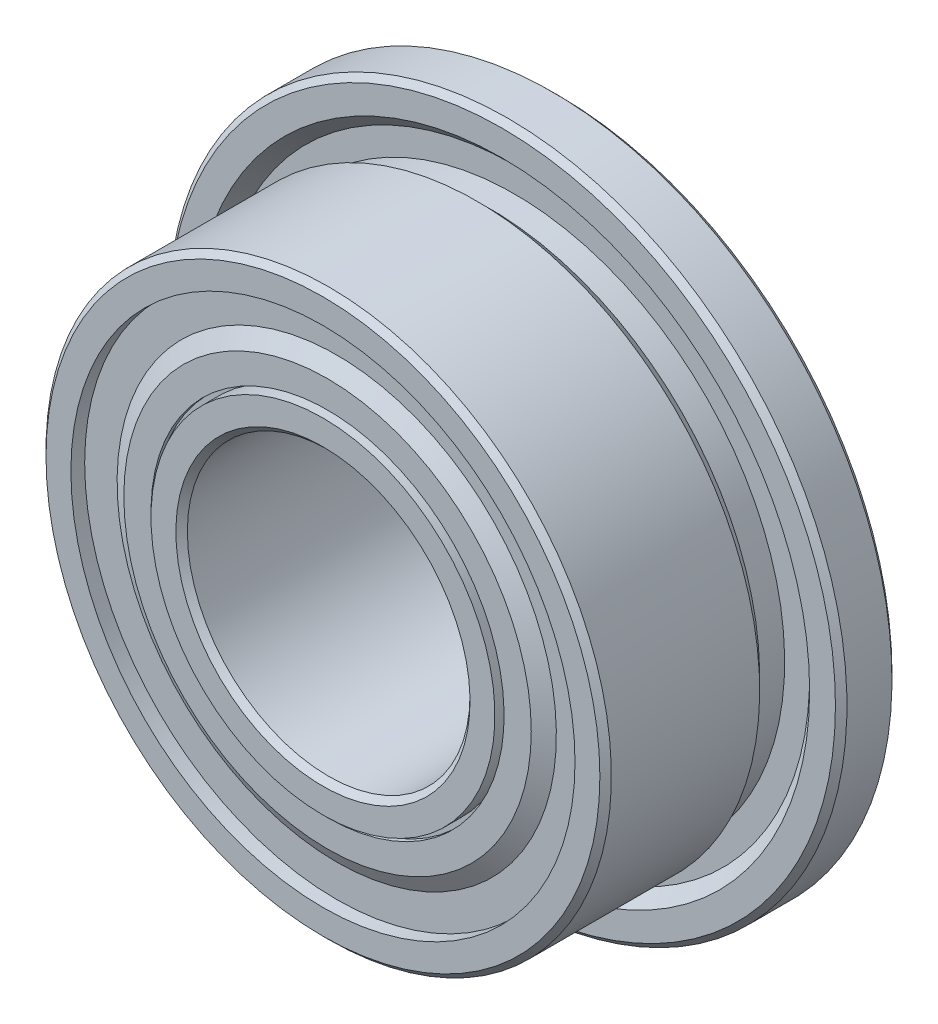
from build123d import *

# Parameters (mm, degrees)
FILLET1_SIZE      = 0.0609375
FILLET2_SIZE      = 0.0609375
CIRPATTERN3_COUNT = 14
SKETCH8_W         = 0.195
SKETCH8_H         = 0.1625


with BuildPart() as part:
    # Sketch2 → Revolve1 (revolve)
    with BuildSketch(Plane(origin=(0, 0, 0), x_dir=(0, 0, -1), z_dir=(1, 0, 0))):
        with BuildLine():
            Line((1.25, 3.6), (0.65, 3.6))
            Line((0.65, 3.6), (0.65, 3.265165043))
            Line((0.65, 3.265165043), (0.782582521, 3.132582521))
            Line((0.782582521, 3.132582521), (0.782582521, 2.867417479))
            Line((0.782582521, 2.867417479), (0.517417479, 2.867417479))
            Line((0.517417479, 2.867417479), (0.384834957, 3))
            Line((0.384834957, 3), (-1.25, 3))
            Line((-1.25, 3), (-1.25, 2.5125))
            Line((-1.25, 2.5125), (-0.301817412, 2.5125))
            ThreePointArc((-0.301817412, 2.5125), (0, 2.65), (0.301817412, 2.5125))
            Line((0.301817412, 2.5125), (1.25, 2.5125))
            Line((1.25, 2.5125), (1.25, 3.6))
        make_face()
        with BuildLine():
            Line((1.25, 1.5), (-1.25, 1.5))
            Line((-1.25, 1.5), (-1.25, 1.9875))
            Line((-1.25, 1.9875), (-0.301817412, 1.9875))
            ThreePointArc((-0.301817412, 1.9875), (0, 1.85), (0.301817412, 1.9875))
            Line((0.301817412, 1.9875), (1.25, 1.9875))
            Line((1.25, 1.9875), (1.25, 1.5))
        make_face()
    revolve(axis=Axis((0, 0, 0), (0, 0, -1)))

    # Fillet1
    fillet1_edges = [part.edges().sort_by_distance(p)[0] for p in [
        (0, -3.6, -1.25),
        (0, -3.6, -0.65),
        (0, -3, 1.25),
    ]]
    chamfer(fillet1_edges, length=FILLET1_SIZE)

    # Fillet2
    fillet2_edges = [part.edges().sort_by_distance(p)[0] for p in [
        (0, -1.5, -1.25),
        (0, -1.5, 1.25),
    ]]
    chamfer(fillet2_edges, length=FILLET2_SIZE)

    # Sketch8 → Cut-Revolve1 (revolve, cut)
    with BuildSketch(Plane(origin=(0, 0, 0), x_dir=(0, 0, -1), z_dir=(1, 0, 0))):
        with Locations((-1.1525, 2.59375)):
            Rectangle(SKETCH8_W, SKETCH8_H)
        with Locations((1.1525, 2.59375)):
            Rectangle(SKETCH8_W, SKETCH8_H)
        with Locations((1.1525, 1.90625)):
            Rectangle(SKETCH8_W, SKETCH8_H)
        with Locations((-1.1525, 1.90625)):
            Rectangle(SKETCH8_W, SKETCH8_H)
    revolve(axis=Axis((0, 0, 0), (0, 0, -1)), mode=Mode.SUBTRACT)


with BuildPart() as body_2:
    # Sketch7 → Revolve3 (revolve)
    with BuildSketch(Plane.XY):
        with BuildLine():
            Line((0, 2.65), (0, 1.85))
            ThreePointArc((0, 1.85), (-0.4, 2.25), (0, 2.65))
        make_face()
    revolve(axis=Axis((0, 2.65, 0), (0, -1, 0)))


with BuildPart() as cirpattern3_1:
    # CirPattern3: pattern copy
    add(body_2.part.rotate(Axis((0, 0, 0), (0, 0, -1)), 1 * 360 / CIRPATTERN3_COUNT))


with BuildPart() as cirpattern3_2:
    # CirPattern3: pattern copy
    add(body_2.part.rotate(Axis((0, 0, 0), (0, 0, -1)), 2 * 360 / CIRPATTERN3_COUNT))


with BuildPart() as cirpattern3_3:
    # CirPattern3: pattern copy
    add(body_2.part.rotate(Axis((0, 0, 0), (0, 0, -1)), 3 * 360 / CIRPATTERN3_COUNT))


with BuildPart() as cirpattern3_4:
    # CirPattern3: pattern copy
    add(body_2.part.rotate(Axis((0, 0, 0), (0, 0, -1)), 4 * 360 / CIRPATTERN3_COUNT))


with BuildPart() as cirpattern3_5:
    # CirPattern3: pattern copy
    add(body_2.part.rotate(Axis((0, 0, 0), (0, 0, -1)), 5 * 360 / CIRPATTERN3_COUNT))


with BuildPart() as cirpattern3_6:
    # CirPattern3: pattern copy
    add(body_2.part.rotate(Axis((0, 0, 0), (0, 0, -1)), 6 * 360 / CIRPATTERN3_COUNT))


with BuildPart() as cirpattern3_7:
    # CirPattern3: pattern copy
    add(body_2.part.rotate(Axis((0, 0, 0), (0, 0, -1)), 7 * 360 / CIRPATTERN3_COUNT))


with BuildPart() as cirpattern3_8:
    # CirPattern3: pattern copy
    add(body_2.part.rotate(Axis((0, 0, 0), (0, 0, -1)), 8 * 360 / CIRPATTERN3_COUNT))


with BuildPart() as cirpattern3_9:
    # CirPattern3: pattern copy
    add(body_2.part.rotate(Axis((0, 0, 0), (0, 0, -1)), 9 * 360 / CIRPATTERN3_COUNT))


with BuildPart() as cirpattern3_10:
    # CirPattern3: pattern copy
    add(body_2.part.rotate(Axis((0, 0, 0), (0, 0, -1)), 10 * 360 / CIRPATTERN3_COUNT))


with BuildPart() as cirpattern3_11:
    # CirPattern3: pattern copy
    add(body_2.part.rotate(Axis((0, 0, 0), (0, 0, -1)), 11 * 360 / CIRPATTERN3_COUNT))


with BuildPart() as cirpattern3_12:
    # CirPattern3: pattern copy
    add(body_2.part.rotate(Axis((0, 0, 0), (0, 0, -1)), 12 * 360 / CIRPATTERN3_COUNT))


with BuildPart() as cirpattern3_13:
    # CirPattern3: pattern copy
    add(body_2.part.rotate(Axis((0, 0, 0), (0, 0, -1)), 13 * 360 / CIRPATTERN3_COUNT))


with BuildPart() as body_16:
    # Sketch9 → Revolve4 (revolve)
    with BuildSketch(Plane(origin=(0, 0, 0), x_dir=(0, 0, -1), z_dir=(1, 0, 0))):
        Polygon((-1.055, 2.675), (-1.055, 2.317857143), (-1.1525, 2.148982189), (-1.1525, 1.87375), (-1.20125, 1.87375), (-1.20125, 2.162044712), (-1.10375, 2.330919666), (-1.10375, 2.675), align=None)
        Polygon((1.055, 2.675), (1.055, 2.317857143), (1.1525, 2.148982189), (1.1525, 1.87375), (1.20125, 1.87375), (1.20125, 2.162044712), (1.10375, 2.330919666), (1.10375, 2.675), align=None)
    revolve(axis=Axis((0, 0, 0), (0, 0, -1)))


solid = Compound([part.part, body_2.part, cirpattern3_1.part, cirpattern3_2.part, cirpattern3_3.part, cirpattern3_4.part, cirpattern3_5.part, cirpattern3_6.part, cirpattern3_7.part, cirpattern3_8.part, cirpattern3_9.part, cirpattern3_10.part, cirpattern3_11.part, cirpattern3_12.part, cirpattern3_13.part, body_16.part])
